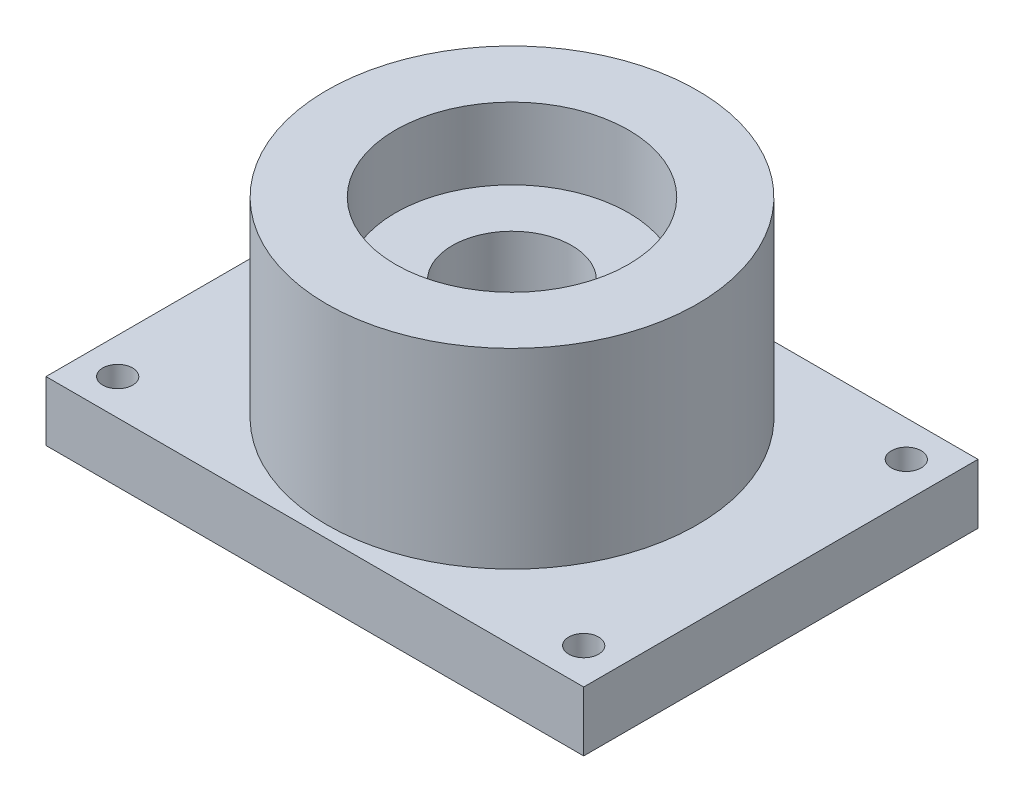
from build123d import *

# Parameters (mm, degrees)
SKETCH1_R           = 15.5
BOSS_EXTRUDE1_DEPTH = 16
SKETCH16_W          = 45
SKETCH16_H          = 33
SKETCH16_R          = 1.25
BOSS_EXTRUDE6_DEPTH = 5
SKETCH17_R          = 9.75
CUT_EXTRUDE5_DEPTH  = 6
SKETCH18_R          = 5
CUT_EXTRUDE7_DEPTH  = 19


with BuildPart() as part:
    # Sketch1 → Boss-Extrude1 (new body)
    with BuildSketch(Plane(origin=(0, 0, 0), x_dir=(1, 0, 0), z_dir=(0, 1, 0))):
        Circle(SKETCH1_R)
    extrude(amount=BOSS_EXTRUDE1_DEPTH)

    # Sketch16 → Boss-Extrude6 (add)
    with BuildSketch(Plane.XZ):
        Rectangle(SKETCH16_W, SKETCH16_H)
        with Locations((-19.5, -13.5)):
            Circle(SKETCH16_R, mode=Mode.SUBTRACT)
        with Locations((19.5, -13.5)):
            Circle(SKETCH16_R, mode=Mode.SUBTRACT)
        with Locations((19.5, 13.5)):
            Circle(SKETCH16_R, mode=Mode.SUBTRACT)
        with Locations((-19.5, 13.5)):
            Circle(SKETCH16_R, mode=Mode.SUBTRACT)
    extrude(amount=BOSS_EXTRUDE6_DEPTH)

    # Sketch17 → Cut-Extrude5 (cut)
    with BuildSketch(Plane(origin=(0, 16, 0), x_dir=(1, 0, 0), z_dir=(0, 1, 0))):
        Circle(SKETCH17_R)
    extrude(amount=-CUT_EXTRUDE5_DEPTH, mode=Mode.SUBTRACT)

    # Sketch18 → Cut-Extrude7 (cut)
    with BuildSketch(Plane(origin=(0, 10, 0), x_dir=(1, 0, 0), z_dir=(0, 1, 0))):
        Circle(SKETCH18_R)
    extrude(amount=-CUT_EXTRUDE7_DEPTH, mode=Mode.SUBTRACT)


solid = part.part
